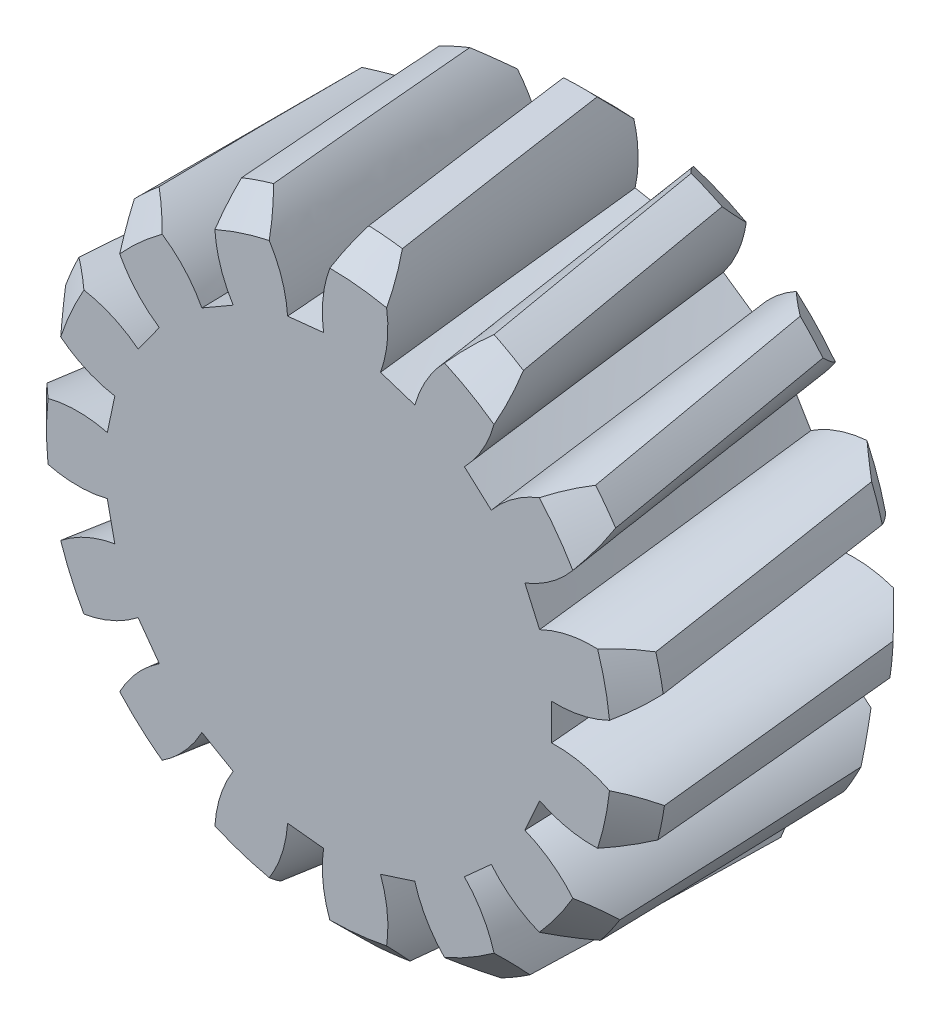
from build123d import *

# Parameters (mm, degrees)
SKETCH5_R           = 11
BOSS_EXTRUDE1_DEPTH = 10
CHAMFER1_SIZE       = 1
CUT_SWEEP1_PITCH    = 500
CIRPATTERN1_COUNT   = 15
SKETCH11_R          = 2.95
CUT_EXTRUDE1_DEPTH  = 2.75


with BuildPart() as part:
    # Sketch5 → Boss-Extrude1 (new body)
    with BuildSketch(Plane(origin=(0, 0, 0), x_dir=(0, 1, 0), z_dir=(0, 0, 1))):
        with Locations(Location((0, 0, 0), (0, 0, 270))):
            Circle(SKETCH5_R)
    extrude(amount=BOSS_EXTRUDE1_DEPTH)

    # Chamfer1
    chamfer1_edges = [part.edges().sort_by_distance(p)[0] for p in [
        (-11, 0, 0),
        (-11, 0, 10),
    ]]
    chamfer(chamfer1_edges, length=CHAMFER1_SIZE)

    # Cut-Sweep1: the profile of Sketch10 screwed along a left-hand helix of 0.04 turns, 58 arcs to a turn; built about Z, then put on its axis
    cut_sweep1_z = Axis((0, 0, 0), (0, 0, 1))
    cut_sweep1_corners = [(-7.887842472, 0.64, 0), (-7.887842472, -0.64, 0), (-10.867842472, -1.7, 0), (-10.867842472, 1.7, 0)]
    with BuildLine(mode=Mode.PRIVATE) as cut_sweep1_profile:
        Line(cut_sweep1_corners[0], cut_sweep1_corners[1])
        ThreePointArc((-7.887842472, -0.64, 0), (-9.479864646, -0.883182944, 0), (-10.867842472, -1.7, 0))
        ThreePointArc((-10.867842472, -1.7, 0), (-11, 0, 0), (-10.867842472, 1.7, 0))
        ThreePointArc((-10.867842472, 1.7, 0), (-9.479864646, 0.883182944, 0), (-7.887842472, 0.64, 0))
    cut_sweep1_cap = Face(cut_sweep1_profile.wire())
    cut_sweep1_arcs = [((-7.887842472, -0.64, 0), (-9.589738456, -0.574292423, 0), (-10.867842472, -1.7, 0), (1, 0.9285395163168806, 1)), ((-10.867842472, -1.7, 0), (-11.133764619, 0, 0), (-10.867842472, 1.7, 0), (1, 0.9879856792885915, 1)), ((-10.867842472, 1.7, 0), (-9.589738456, 0.574292423, 0), (-7.887842472, 0.64, 0), (1, 0.9285395163168806, 1))]  # start, shoulder, end, weights
    cut_sweep1_turn_angles = [0, -3.103448276, -6.206896552, -9.310344828, -12.413793103, -13.406896552, -14.4]
    cut_sweep1_turn_weights = [1, 0.9985334138511238, 1, 0.9985334138511238, 1, 0.9998497886164538, 1]
    cut_sweep1_turn_rails = [Edge.make_bspline([Vector(p[0], p[1], 0).rotate(cut_sweep1_z, cut_sweep1_turn_angles[k]) / cut_sweep1_turn_weights[k] + Vector(0, 0, p[2] + -CUT_SWEEP1_PITCH * cut_sweep1_turn_angles[k] / 360) for k in range(7)], [0, 0, 0, 1, 1, 2, 2, 3, 3, 3], 2, cut_sweep1_turn_weights) for p in cut_sweep1_corners]
    cut_sweep1_turn_sides = [*[Face.make_surface_from_curves(cut_sweep1_turn_rails[p[0]], cut_sweep1_turn_rails[p[1]]) for p in [(0, 1)]], *[Face.make_bezier_surface([[Vector(p[j][0], p[j][1], 0).rotate(cut_sweep1_z, cut_sweep1_turn_angles[2 * i + k]) / cut_sweep1_turn_weights[2 * i + k] + Vector(0, 0, p[j][2] + -CUT_SWEEP1_PITCH * cut_sweep1_turn_angles[2 * i + k] / 360) for k in range(3)] for j in range(3)], [[p[3][j] * cut_sweep1_turn_weights[2 * i + k] for k in range(3)] for j in range(3)]) for p in cut_sweep1_arcs for i in range(3)]]
    cut_sweep1 = Plane(origin=(0, 0, 10), x_dir=(-1, 0, 0), z_dir=(0, 0, -1)) * Solid(Shell([*cut_sweep1_turn_sides, cut_sweep1_cap, cut_sweep1_cap.rotate(cut_sweep1_z, -14.4).moved(Location((0, 0, -CUT_SWEEP1_PITCH * -14.4 / 360)))]))
    add(cut_sweep1, mode=Mode.SUBTRACT)

    # CirPattern1: Cut-Sweep1 ×15 about axis
    cirpattern1_axis = Axis((0, 0, 10), (0, 0, -1))
    for i in range(1, CIRPATTERN1_COUNT):
        add(cut_sweep1.rotate(cirpattern1_axis, i * 360 / CIRPATTERN1_COUNT), mode=Mode.SUBTRACT)

    # Sketch11 → Cut-Extrude1 (cut)
    with BuildSketch(Plane(origin=(0, 0, 0), x_dir=(0, 1, 0), z_dir=(0, 0, 1))):
        with Locations(Location((0, 0, 0), (0, 0, 270))):
            Circle(SKETCH11_R)
    extrude(amount=CUT_EXTRUDE1_DEPTH, mode=Mode.SUBTRACT)


solid = part.part
